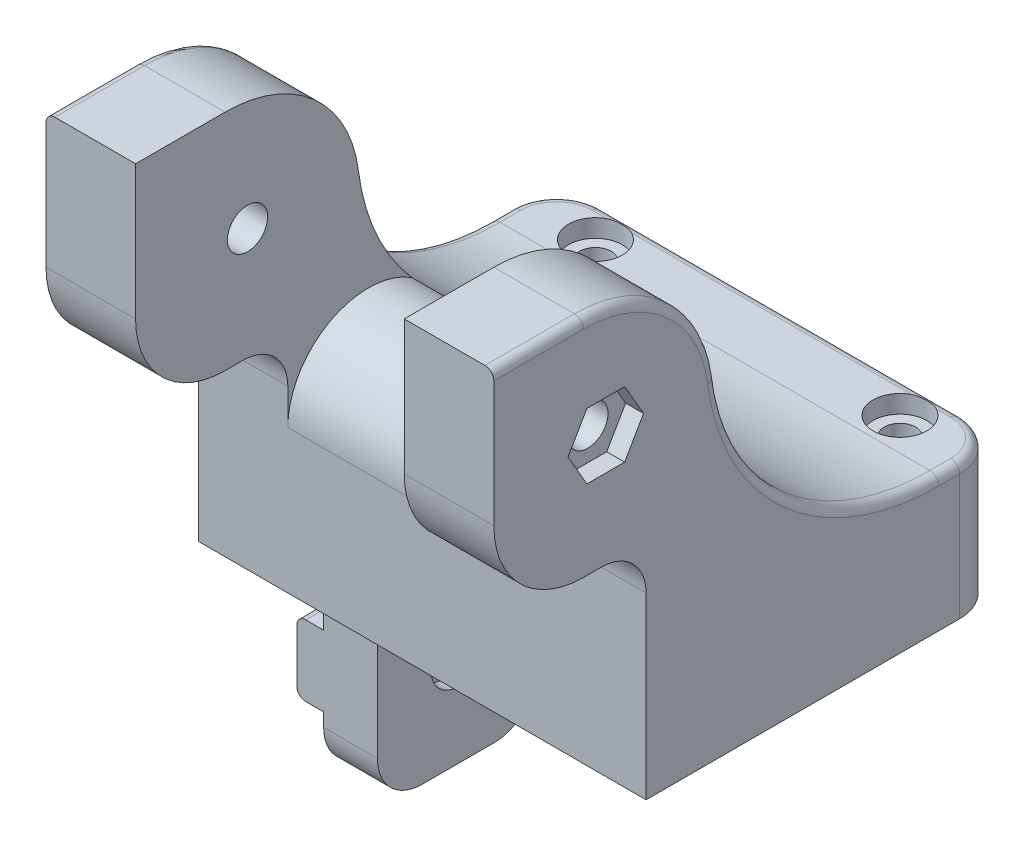
from build123d import *

# Parameters (mm, degrees)
CROQUIS1_W              = 50
CROQUIS1_H              = 40
SALIENTE_EXTRUIR1_DEPTH = 25
CROQUIS4_W              = 10
CROQUIS4_H              = 25
SALIENTE_EXTRUIR3_DEPTH = 25
CORTAR_EXTRUIR2_REACH   = 83.24
CROQUIS5_R              = 2.25
REDONDEO4_R             = 15
REDONDEO5_R             = 10
REDONDEO6_R             = 9
CROQUIS6_W              = 50
CROQUIS6_H              = 31
CORTAR_EXTRUIR3_DEPTH   = 10
CROQUIS7_W              = 50
CROQUIS7_H              = 10
CORTAR_EXTRUIR4_DEPTH   = 1
REDONDEO7_DEPTH         = 50
REDONDEO7_2_DEPTH       = 10
REDONDEO7_START         = 40
REDONDEO7_3_DEPTH       = 10
REDONDEO8_R             = 5
CROQUIS8_R              = 1.75
CORTAR_EXTRUIR5_DEPTH   = 15
CROQUIS9_R              = 3
CORTAR_EXTRUIR6_DEPTH   = 2
REDONDEO9_R             = 5
CROQUIS10_W             = 6
CROQUIS10_H             = 18
SALIENTE_EXTRUIR4_DEPTH = 30
CROQUIS11_W             = 18
CROQUIS11_H             = 7.9
SALIENTE_EXTRUIR5_DEPTH = 3
REDONDEO10_R            = 1
CROQUIS12_R             = 1.75
CORTAR_EXTRUIR7_DEPTH   = 9
CROQUIS13_R             = 3
CORTAR_EXTRUIR8_DEPTH   = 1.5
CROQUIS16_R             = 1.75
CORTAR_EXTRUIR9_DEPTH   = 82.240384046
CROQUIS17_R             = 3
CORTAR_EXTRUIR10_DEPTH  = 5.5
REDONDEO11_R            = 5
REDONDEO12_R            = 1
CROQUIS18_R             = 3.55
CORTAR_EXTRUIR11_DEPTH  = 2
CORTAR_EXTRUIR12_DEPTH  = 2


with BuildPart() as part:
    # Croquis1 → Saliente-Extruir1 (new body)
    with BuildSketch(Plane(origin=(0, 0, 0), x_dir=(1, 0, 0), z_dir=(0, 1, 0))):
        with Locations((25, 20)):
            Rectangle(CROQUIS1_W, CROQUIS1_H)
    extrude(amount=SALIENTE_EXTRUIR1_DEPTH)

    # Croquis4 → Saliente-Extruir3 (add)
    with BuildSketch(Plane(origin=(0, 25, 0), x_dir=(1, 0, 0), z_dir=(0, 1, 0))):
        with Locations((5, -4.5)):
            Rectangle(CROQUIS4_W, CROQUIS4_H)
        with Locations((45, -4.5)):
            Rectangle(CROQUIS4_W, CROQUIS4_H)
    extrude(amount=SALIENTE_EXTRUIR3_DEPTH)

    # Cortar-Extruir2: up to this face of the body (flat: up to its plane)
    cortar_extruir2_end = Plane(part.part.faces().sort_by_distance((0, 22.115384615, -10.576923077))[0])
    # Croquis5 → Cortar-Extruir2 (cut, up to the picked face)
    with BuildSketch(Plane(origin=(50, 0, 0), x_dir=(0, 0, -1), z_dir=(1, 0, 0)), mode=Mode.PRIVATE) as cortar_extruir2_sk1:
        with Locations((-4.5, 37.5)):
            Circle(CROQUIS5_R)
    cortar_extruir2_tool1 = split(extrude(cortar_extruir2_sk1.sketch, amount=-CORTAR_EXTRUIR2_REACH, mode=Mode.PRIVATE), bisect_by=cortar_extruir2_end, keep=Keep.BOTH, mode=Mode.PRIVATE)
    add(cortar_extruir2_tool1.solids().sort_by(Axis((50, 37.5, 4.5), (-1, 0, 0)))[0], mode=Mode.SUBTRACT)

    # Redondeo4
    redondeo4_edges = [part.edges().sort_by_distance(p)[0] for p in [
        (5, 50, -8),
        (45, 50, -8),
    ]]
    fillet(redondeo4_edges, radius=REDONDEO4_R)

    # Redondeo5
    redondeo5_edges = [part.edges().sort_by_distance(p)[0] for p in [
        (5, 25, 17),
        (45, 25, 17),
    ]]
    fillet(redondeo5_edges, radius=REDONDEO5_R)

    # Redondeo6
    # the kernel refuses this fillet: 9 mm, written as the material it takes off along each edge
    with BuildSketch(Plane(origin=(-12.5, 25, 0), x_dir=(0, -1, 0), z_dir=(1, 0, 0))) as redondeo6_piece_1_section:
        with BuildLine():
            CenterArc((REDONDEO6_R, REDONDEO6_R), REDONDEO6_R, 180, 90)
            Line((0, REDONDEO6_R), (0, 0))
            Line((0, 0), (REDONDEO6_R, 0))
        make_face()
    redondeo6_piece_1 = extrude(amount=75, mode=Mode.PRIVATE)
    redondeo6_piece_1 = split(redondeo6_piece_1, bisect_by=Plane(origin=(-12.5, 25, -8), z_dir=(0, 0, -1)), keep=Keep.TOP, mode=Mode.PRIVATE)
    add(redondeo6_piece_1, mode=Mode.SUBTRACT)
    with BuildSketch(Plane(origin=(10, 25, 0), x_dir=(0, -1, 0), z_dir=(1, 0, 0))) as redondeo6_piece_2:
        with BuildLine():
            CenterArc((REDONDEO6_R, REDONDEO6_R), REDONDEO6_R, 180, 90)
            Line((0, REDONDEO6_R), (0, 0))
            Line((0, 0), (REDONDEO6_R, 0))
        make_face()
    extrude(amount=30, mode=Mode.SUBTRACT)

    # Croquis6 → Cortar-Extruir3 (cut)
    with BuildSketch(Plane(origin=(0, 25, 0), x_dir=(1, 0, 0), z_dir=(0, 1, 0))):
        with Locations((25, 24.5)):
            Rectangle(CROQUIS6_W, CROQUIS6_H)
    extrude(amount=-CORTAR_EXTRUIR3_DEPTH, mode=Mode.SUBTRACT)

    # Croquis7 → Cortar-Extruir4 (cut)
    with BuildSketch(Plane(origin=(0, 0, -9), x_dir=(-1, 0, 0), z_dir=(0, 0, -1))):
        with Locations((-25, 20)):
            Rectangle(CROQUIS7_W, CROQUIS7_H)
    extrude(amount=-CORTAR_EXTRUIR4_DEPTH, mode=Mode.SUBTRACT)

    # Redondeo7: read off the stored shape, not the designer's step
    # Redondeo7 outline → Redondeo7 (add)
    with BuildSketch(Plane.YZ):
        with BuildLine():
            ThreePointArc((15, -32.686269666), (17.252745058, -22.315040587), (23.604991409, -13.812910312))
            ThreePointArc((23.604991409, -13.812910312), (24.770234357, -11.020640821), (24.94427191, -8))
            Line((24.94427191, -8), (15, -8))
            Line((15, -8), (15, -32.686269666))
        make_face()
    extrude(amount=REDONDEO7_DEPTH)

    # Redondeo7 2 outline → Redondeo7 2 (add)
    with BuildSketch(Plane.YZ):
        with BuildLine():
            ThreePointArc((24.94427191, -8), (24.770234357, -11.020640821), (23.604991409, -13.812910312))
            ThreePointArc((23.604991409, -13.812910312), (29.799482027, -9.86195296), (36.875, -7.882351125))
            ThreePointArc((36.875, -7.882351125), (35.939342999, -7.970558932), (35, -8))
            Line((35, -8), (24.94427191, -8))
        make_face()
    extrude(amount=REDONDEO7_2_DEPTH)

    # Redondeo7 3 outline → Redondeo7 3 (add)
    with BuildSketch(Plane.YZ.offset(REDONDEO7_START)):
        with BuildLine():
            ThreePointArc((24.94427191, -8), (24.770234357, -11.020640821), (23.604991409, -13.812910312))
            ThreePointArc((23.604991409, -13.812910312), (29.799482027, -9.86195296), (36.875, -7.882351125))
            ThreePointArc((36.875, -7.882351125), (35.939342999, -7.970558932), (35, -8))
            Line((35, -8), (24.94427191, -8))
        make_face()
    extrude(amount=REDONDEO7_3_DEPTH)

    # Redondeo8
    redondeo8_edges = [part.edges().sort_by_distance(p)[0] for p in [
        (45, 25, 0),
        (5, 25, 0),
    ]]
    fillet(redondeo8_edges, radius=REDONDEO8_R)

    # Croquis8 → Cortar-Extruir5 (cut)
    with BuildSketch(Plane(origin=(0, 15, 0), x_dir=(1, 0, 0), z_dir=(0, 1, 0))):
        with Locations(Location((8, 36.343134833, 0), (0, 0, 270))):
            Circle(CROQUIS8_R)
        with Locations(Location((42, 36.343134833, 0), (0, 0, 270))):
            Circle(CROQUIS8_R)
    extrude(amount=-CORTAR_EXTRUIR5_DEPTH, mode=Mode.SUBTRACT)

    # Croquis9 → Cortar-Extruir6 (cut)
    with BuildSketch(Plane(origin=(0, 15, 0), x_dir=(1, 0, 0), z_dir=(0, 1, 0))):
        with Locations(Location((8, 36.343134833, 0), (0, 0, 270))):
            Circle(CROQUIS9_R)
        with Locations(Location((42, 36.343134833, 0), (0, 0, 270))):
            Circle(CROQUIS9_R)
    extrude(amount=-CORTAR_EXTRUIR6_DEPTH, mode=Mode.SUBTRACT)

    # Redondeo9
    redondeo9_edges = [part.edges().sort_by_distance(p)[0] for p in [
        (0, 7.5, -40),
        (50, 7.5, -40),
    ]]
    fillet(redondeo9_edges, radius=REDONDEO9_R)

    # Croquis10 → Saliente-Extruir4 (add)
    with BuildSketch(Plane.XZ):
        with Locations((3, -23)):
            Rectangle(CROQUIS10_W, CROQUIS10_H)
    extrude(amount=SALIENTE_EXTRUIR4_DEPTH)

    # Croquis11 → Saliente-Extruir5 (add)
    with BuildSketch(Plane.ZY):
        with Locations((-23, -19.55)):
            Rectangle(CROQUIS11_W, CROQUIS11_H)
    extrude(amount=SALIENTE_EXTRUIR5_DEPTH)

    # Redondeo10
    redondeo10_edges = [part.edges().sort_by_distance(p)[0] for p in [
        (-3, -23.5, -23),
        (-3, -15.6, -23),
    ]]
    fillet(redondeo10_edges, radius=REDONDEO10_R)

    # Croquis12 → Cortar-Extruir7 (cut)
    with BuildSketch(Plane.ZY.offset(3)):
        with Locations((-23, -19.55)):
            Circle(CROQUIS12_R)
    extrude(amount=-CORTAR_EXTRUIR7_DEPTH, mode=Mode.SUBTRACT)

    # Croquis13 → Cortar-Extruir8 (cut)
    with BuildSketch(Plane(origin=(6, 0, 0), x_dir=(0, 0, -1), z_dir=(1, 0, 0))):
        with Locations((23, -19.55)):
            Circle(CROQUIS13_R)
    extrude(amount=-CORTAR_EXTRUIR8_DEPTH, mode=Mode.SUBTRACT)

    # Croquis16 → Cortar-Extruir9 (cut, through all)
    with BuildSketch(Plane.XZ):
        with Locations(Location((25, -25.343134833, 0), (0, 0, 270))):
            Circle(CROQUIS16_R)
    extrude(amount=-CORTAR_EXTRUIR9_DEPTH, mode=Mode.SUBTRACT)

    # Croquis17 → Cortar-Extruir10 (cut)
    with BuildSketch(Plane(origin=(0, 20, 0), x_dir=(1, 0, 0), z_dir=(0, 1, 0))):
        with Locations(Location((25, 25.343134833, 0), (0, 0, 270))):
            Circle(CROQUIS17_R)
    extrude(amount=-CORTAR_EXTRUIR10_DEPTH, mode=Mode.SUBTRACT)

    # Redondeo11
    redondeo11_edges = [part.edges().sort_by_distance(p)[0] for p in [
        (3, -30, -32),
        (3, -30, -14),
    ]]
    fillet(redondeo11_edges, radius=REDONDEO11_R)

    # Redondeo12
    # the kernel refuses this fillet: 1 mm, written as the material it takes off along each edge
    with BuildSketch(Plane(origin=(50, 35, 7), x_dir=(0, 1, 0), z_dir=(0, 0, 1))) as redondeo12_piece_1:
        with BuildLine():
            CenterArc((15 - REDONDEO12_R, REDONDEO12_R), REDONDEO12_R, 270, 90)
            Line((15, REDONDEO12_R), (15, 0))
            Line((15, 0), (15 - REDONDEO12_R, 0))
        make_face()
    revolve(axis=Axis((50, 35, 7), (-1, 0, 0)), revolution_arc=82.819244219, mode=Mode.SUBTRACT)
    with BuildSketch(Plane(origin=(50, 15, -32.686269666), x_dir=(0, -1, 0), z_dir=(0, 0, -1))) as redondeo12_piece_2:
        with BuildLine():
            CenterArc((REDONDEO12_R, REDONDEO12_R), REDONDEO12_R, 180, 90)
            Line((0, REDONDEO12_R), (0, 0))
            Line((0, 0), (REDONDEO12_R, 0))
        make_face()
    extrude(amount=2.313730334, mode=Mode.SUBTRACT)
    with BuildSketch(Plane(origin=(0, 39.999999999, -32.686269666), x_dir=(0, -1.0, -1.5997443370402977e-11), z_dir=(0, 1.5997443370402977e-11, -1.0))) as redondeo12_piece_3:
        with BuildLine():
            CenterArc((24.999999999 + REDONDEO12_R, -REDONDEO12_R), REDONDEO12_R, 90, 90)
            Line((24.999999999, -REDONDEO12_R), (24.999999999, 0))
            Line((24.999999999, 0), (24.999999999 + REDONDEO12_R, 0))
        make_face()
    revolve(axis=Axis((0, 39.999999999, -32.686269666), (-1, 0, 0)), revolution_arc=49.019635862, mode=Mode.SUBTRACT)
    with BuildSketch(Plane(origin=(50, 39.999999999, -32.686269666), x_dir=(0, -1.0, -1.5997443370402977e-11), z_dir=(0, 1.5997443370402977e-11, -1.0))) as redondeo12_piece_4:
        with BuildLine():
            CenterArc((24.999999999 + REDONDEO12_R, REDONDEO12_R), REDONDEO12_R, 180, 90)
            Line((24.999999999, REDONDEO12_R), (24.999999999, 0))
            Line((24.999999999, 0), (24.999999999 + REDONDEO12_R, 0))
        make_face()
    revolve(axis=Axis((50, 39.999999999, -32.686269666), (-1, 0, 0)), revolution_arc=49.019635862, mode=Mode.SUBTRACT)
    with BuildSketch(Plane(origin=(0, 15, -32.686269666), x_dir=(0, -1, 0), z_dir=(0, 0, -1))) as redondeo12_piece_5:
        with BuildLine():
            CenterArc((REDONDEO12_R, -REDONDEO12_R), REDONDEO12_R, 90, 90)
            Line((0, -REDONDEO12_R), (0, 0))
            Line((0, 0), (REDONDEO12_R, 0))
        make_face()
    extrude(amount=2.313730334, mode=Mode.SUBTRACT)
    with BuildSketch(Plane(origin=(45, 15, -40), x_dir=(0, -1, 0), z_dir=(-1, 0, 0))) as redondeo12_piece_6:
        with BuildLine():
            CenterArc((REDONDEO12_R, REDONDEO12_R), REDONDEO12_R, 180, 90)
            Line((0, REDONDEO12_R), (0, 0))
            Line((0, 0), (REDONDEO12_R, 0))
        make_face()
    extrude(amount=40, mode=Mode.SUBTRACT)
    with BuildSketch(Plane(origin=(45, 15, -35), x_dir=(0, 0, -1), z_dir=(-1, 0, 0))) as redondeo12_piece_7:
        with BuildLine():
            CenterArc((5 - REDONDEO12_R, REDONDEO12_R), REDONDEO12_R, 270, 90)
            Line((5 - REDONDEO12_R, 0), (5, 0))
            Line((5, 0), (5, REDONDEO12_R))
        make_face()
    revolve(axis=Axis((45, 15, -35), (0, -1, 0)), revolution_arc=90, mode=Mode.SUBTRACT)
    with BuildSketch(Plane(origin=(5, 15, -35), x_dir=(-1, 0, 0), z_dir=(0, 0, 1))) as redondeo12_piece_8:
        with BuildLine():
            CenterArc((5 - REDONDEO12_R, REDONDEO12_R), REDONDEO12_R, 270, 90)
            Line((5 - REDONDEO12_R, 0), (5, 0))
            Line((5, 0), (5, REDONDEO12_R))
        make_face()
    revolve(axis=Axis((5, 15, -35), (0, -1, 0)), revolution_arc=90, mode=Mode.SUBTRACT)
    with BuildSketch(Plane(origin=(50, 50, 19.5), x_dir=(0, -1, 0), z_dir=(0, 0, -1))) as redondeo12_piece_9:
        with BuildLine():
            CenterArc((REDONDEO12_R, REDONDEO12_R), REDONDEO12_R, 180, 90)
            Line((0, REDONDEO12_R), (0, 0))
            Line((0, 0), (REDONDEO12_R, 0))
        make_face()
    extrude(amount=12.5, mode=Mode.SUBTRACT)
    with BuildSketch(Plane(origin=(0, 50, 19.5), x_dir=(0, -1, 0), z_dir=(0, 0, -1))) as redondeo12_piece_10:
        with BuildLine():
            CenterArc((REDONDEO12_R, -REDONDEO12_R), REDONDEO12_R, 90, 90)
            Line((0, -REDONDEO12_R), (0, 0))
            Line((0, 0), (REDONDEO12_R, 0))
        make_face()
    extrude(amount=12.5, mode=Mode.SUBTRACT)
    with BuildSketch(Plane(origin=(0, 35, 7), x_dir=(0, 0.12499999999783662, -0.992156741649494), z_dir=(0, -0.992156741649494, -0.12499999999783662))) as redondeo12_piece_11:
        with BuildLine():
            CenterArc((15 - REDONDEO12_R, REDONDEO12_R), REDONDEO12_R, 270, 90)
            Line((15, REDONDEO12_R), (15, 0))
            Line((15, 0), (15 - REDONDEO12_R, 0))
        make_face()
    revolve(axis=Axis((0, 35, 7), (1, 0, 0)), revolution_arc=82.819244219, mode=Mode.SUBTRACT)
    with BuildSketch(Plane(origin=(0, 39.999999996, -32.686269659), x_dir=(0, -0.655800343691041, 0.7549343741112287), z_dir=(0, -0.7549343741112287, -0.655800343691041))) as redondeo12_piece_12:
        with BuildLine():
            CenterArc((24.999999992 + REDONDEO12_R, -REDONDEO12_R), REDONDEO12_R, 90, 90)
            Line((24.999999992, -REDONDEO12_R), (24.999999992, 0))
            Line((24.999999992, 0), (24.999999992 + REDONDEO12_R, 0))
        make_face()
    revolve(axis=Axis((0, 39.999999996, -32.686269659), (-1, 0, 0)), revolution_arc=33.799608369, mode=Mode.SUBTRACT)
    with BuildSketch(Plane(origin=(50, 39.999999996, -32.686269659), x_dir=(0, -0.655800343691041, 0.7549343741112287), z_dir=(0, -0.7549343741112287, -0.655800343691041))) as redondeo12_piece_13:
        with BuildLine():
            CenterArc((24.999999992 + REDONDEO12_R, REDONDEO12_R), REDONDEO12_R, 180, 90)
            Line((24.999999992, REDONDEO12_R), (24.999999992, 0))
            Line((24.999999992, 0), (24.999999992 + REDONDEO12_R, 0))
        make_face()
    revolve(axis=Axis((50, 39.999999996, -32.686269659), (-1, 0, 0)), revolution_arc=33.799608369, mode=Mode.SUBTRACT)

    # Croquis18 → Cortar-Extruir11 (cut)
    with BuildSketch(Plane.ZY):
        with Locations((4.5, 37.5)):
            Circle(CROQUIS18_R)
    extrude(amount=-CORTAR_EXTRUIR11_DEPTH, mode=Mode.SUBTRACT)

    # Croquis19 → Cortar-Extruir12 (cut)
    with BuildSketch(Plane(origin=(50, 0, 0), x_dir=(0, 0, -1), z_dir=(1, 0, 0))):
        Polygon((-0.285343035, 37.5), (-2.392671517, 41.15), (-6.607328483, 41.15), (-8.714656965, 37.5), (-6.607328483, 33.85), (-2.392671517, 33.85), align=None)
    extrude(amount=-CORTAR_EXTRUIR12_DEPTH, mode=Mode.SUBTRACT)


solid = part.part
